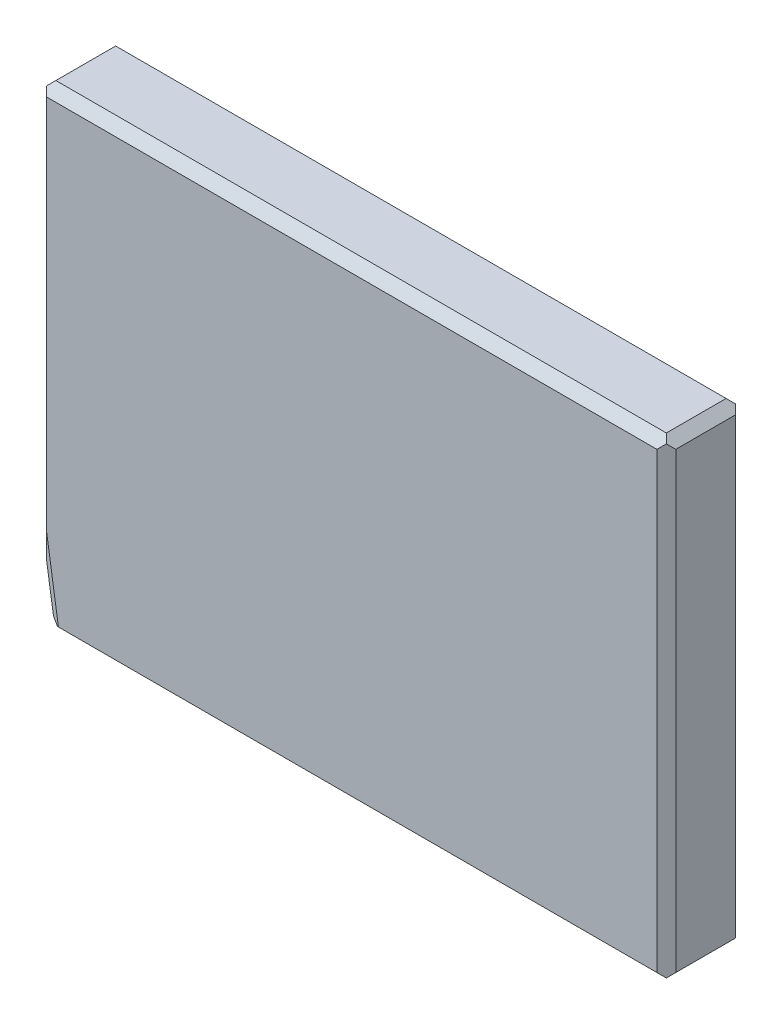
from build123d import *

# Parameters (mm, degrees)
SKETCH1_W        = 101.6
SKETCH1_H        = 76.2
PLATE_DEPTH      = 12.7
CHAMFER1_SIZE    = 1.524
CHAMFER3_SIZE    = 1.524
CHAMFER5_SIZE    = 1.524
CHAMFER7_SIZE    = 1.524
CHAMFER7_SIZE2   = 4.163645431
CHAMFER9_SIZE    = 1.524
CHAMFER9_SIZE2   = 4.163645431
CHAMFER10_SIZE   = 1.524
CHAMFER10_SIZE2  = 4.163645431
CHAMFER11_SIZE   = 1.524
CHAMFER11_SIZE2  = 1.98931977
CHAMFER12_SIZE   = 1.524
CHAMFER12_SIZE2  = 1.98931977
CHAMFER14_SIZE   = 1.524
CHAMFER14_SIZE2  = 2.500509831
CHAMFER18_SIZE   = 1.524
CHAMFER18_SIZE2  = 1.98931977
CHAMFER19_SIZE   = 4.927310365
CHAMFER19_SIZE_2 = 1.524
CHAMFER27_SIZE   = 4.163645431
CHAMFER27_SIZE_2 = 1.524
CHAMFER29_SIZE   = 1.524
CHAMFER33_SIZE   = 1.524
CHAMFER37_SIZE   = 1.524
CHAMFER41_SIZE   = 1.524
CHAMFER43_SIZE   = 1.524
CHAMFER47_SIZE   = 1.524
CHAMFER52_SIZE   = 1.524
CHAMFER57_SIZE   = 1.524
CHAMFER59_SIZE   = 1.524
CHAMFER63_SIZE   = 1.524
CHAMFER68_SIZE   = 1.524


with BuildPart() as part:
    # Sketch1 → plate (new body)
    with BuildSketch(Plane.XY):
        with Locations((50.8, 38.1)):
            Rectangle(SKETCH1_W, SKETCH1_H)
    extrude(amount=PLATE_DEPTH)

    # Chamfer1
    chamfer1_edges = [part.edges().sort_by_distance(p)[0] for p in [
        (0, 0, 6.35),
    ]]
    chamfer(chamfer1_edges, length=CHAMFER1_SIZE)

    # Chamfer3
    chamfer3_edges = [part.edges().sort_by_distance(p)[0] for p in [
        (0.762, 0.762, 0),
    ]]
    chamfer(chamfer3_edges, length=CHAMFER3_SIZE)

    # Chamfer5
    chamfer5_edges = [part.edges().sort_by_distance(p)[0] for p in [
        (0.762, 0.762, 12.7),
    ]]
    chamfer(chamfer5_edges, length=CHAMFER5_SIZE)

    # Chamfer7
    chamfer7_edges = [part.edges().sort_by_distance(p)[0] for p in [
        (0, 2.601630735, 0.762),
    ]]
    chamfer7_side = [part.faces().sort_by_distance(p)[0] for p in [
        (1.375210245, 1.375210245, 0.656789755),
    ]]
    chamfer(chamfer7_edges, length=CHAMFER7_SIZE, length2=CHAMFER7_SIZE2, reference=chamfer7_side[0])

    # Chamfer9
    chamfer9_edges = [part.edges().sort_by_distance(p)[0] for p in [
        (2.601630735, 0, 0.762),
    ]]
    chamfer9_side = [part.faces().sort_by_distance(p)[0] for p in [
        (2.111722816, 0.7919001, 0.548459281),
    ]]
    chamfer(chamfer9_edges, length=CHAMFER9_SIZE, length2=CHAMFER9_SIZE2, reference=chamfer9_side[0])

    # Chamfer10
    chamfer10_edges = [part.edges().sort_by_distance(p)[0] for p in [
        (0, 2.601630735, 11.938),
    ]]
    chamfer10_side = [part.faces().sort_by_distance(p)[0] for p in [
        (1.375210245, 1.375210245, 12.043210245),
    ]]
    chamfer(chamfer10_edges, length=CHAMFER10_SIZE, length2=CHAMFER10_SIZE2, reference=chamfer10_side[0])

    # Chamfer11
    chamfer11_edges = [part.edges().sort_by_distance(p)[0] for p in [
        (0.659911358, 6.625172827, 0),
    ]]
    chamfer11_side = [part.faces().sort_by_distance(p)[0] for p in [
        (0.497022665, 4.4128662, 2.308870295),
    ]]
    chamfer(chamfer11_edges, length=CHAMFER11_SIZE, length2=CHAMFER11_SIZE2, reference=chamfer11_side[0])

    # Chamfer12
    chamfer12_edges = [part.edges().sort_by_distance(p)[0] for p in [
        (7.206175842, 0.570029878, 0),
    ]]
    chamfer12_side = [part.faces().sort_by_distance(p)[0] for p in [
        (4.492487224, 0.46863969, 2.38230292),
    ]]
    chamfer(chamfer12_edges, length=CHAMFER12_SIZE, length2=CHAMFER12_SIZE2, reference=chamfer12_side[0])

    # Chamfer14
    chamfer14_edges = [part.edges().sort_by_distance(p)[0] for p in [
        (0.96943787, 0.96943787, 2.584421635),
    ]]
    chamfer14_side = [part.faces().sort_by_distance(p)[0] for p in [
        (3.644155143, 0.409792278, 3.25114463),
    ]]
    chamfer(chamfer14_edges, length=CHAMFER14_SIZE, length2=CHAMFER14_SIZE2, reference=chamfer14_side[0])

    # Chamfer18
    chamfer18_edges = [part.edges().sort_by_distance(p)[0] for p in [
        (0.659911358, 6.625172827, 12.7),
    ]]
    chamfer18_side = [part.faces().sort_by_distance(p)[0] for p in [
        (0.533202333, 4.341451886, 10.506002546),
    ]]
    chamfer(chamfer18_edges, length=CHAMFER18_SIZE, length2=CHAMFER18_SIZE2, reference=chamfer18_side[0])

    # Chamfer19
    # the kernel refuses this chamfer: 4.927310365, 1.524 mm, written as the material it takes off along each edge
    with BuildSketch(Plane(origin=(0, -3.953536059, 2.744587717), x_dir=(0, 0.09805092210800737, 0.9951813988785008), z_dir=(0, 0.9951813988785007, -0.09805092210800735))) as chamfer19_piece_1:
        Polygon((CHAMFER19_SIZE, 0), (-CHAMFER19_SIZE_2 * 0.53534007825, CHAMFER19_SIZE_2 * 0.844636608619), (0, 0), align=None)
    extrude(amount=91.989112447, mode=Mode.SUBTRACT)

    # Chamfer27
    # the kernel refuses this chamfer: 4.163645431, 1.524 mm, written as the material it takes off along each edge
    with BuildSketch(Plane(origin=(-7.303820514, 0, 4.933788251), x_dir=(0.5773502691896255, 0, -0.8164965809277261), z_dir=(0.8164965809277263, 0, 0.5773502691896256))) as chamfer27_piece_1:
        Polygon((CHAMFER27_SIZE, 0), (-CHAMFER27_SIZE_2 * 0.5, CHAMFER27_SIZE_2 * 0.866025403784), (0, 0), align=None)
    extrude(amount=24.057251609, mode=Mode.SUBTRACT)

    # Chamfer29
    chamfer29_edges = [part.edges().sort_by_distance(p)[0] for p in [
        (101.6, 0, 6.35),
    ]]
    chamfer(chamfer29_edges, length=CHAMFER29_SIZE)

    # Chamfer33
    chamfer33_edges = [part.edges().sort_by_distance(p)[0] for p in [
        (101.6, 76.2, 6.35),
    ]]
    chamfer(chamfer33_edges, length=CHAMFER33_SIZE)

    # Chamfer37
    chamfer37_edges = [part.edges().sort_by_distance(p)[0] for p in [
        (0, 76.2, 6.35),
    ]]
    chamfer(chamfer37_edges, length=CHAMFER37_SIZE)

    # Chamfer41
    chamfer41_edges = [part.edges().sort_by_distance(p)[0] for p in [
        (50.8, 76.2, 12.7),
    ]]
    chamfer(chamfer41_edges, length=CHAMFER41_SIZE)

    # Chamfer43
    chamfer43_edges = [part.edges().sort_by_distance(p)[0] for p in [
        (101.6, 38.1, 12.7),
    ]]
    chamfer(chamfer43_edges, length=CHAMFER43_SIZE)

    # Chamfer47
    chamfer47_edges = [part.edges().sort_by_distance(p)[0] for p in [
        (55.48345345, 0, 12.7),
    ]]
    chamfer(chamfer47_edges, length=CHAMFER47_SIZE)

    # Chamfer52
    chamfer52_edges = [part.edges().sort_by_distance(p)[0] for p in [
        (0, 49.289518337, 12.7),
    ]]
    chamfer(chamfer52_edges, length=CHAMFER52_SIZE)

    # Chamfer57
    chamfer57_edges = [part.edges().sort_by_distance(p)[0] for p in [
        (50.8, 76.2, 0),
    ]]
    chamfer(chamfer57_edges, length=CHAMFER57_SIZE)

    # Chamfer59
    chamfer59_edges = [part.edges().sort_by_distance(p)[0] for p in [
        (101.6, 38.1, 0),
    ]]
    chamfer(chamfer59_edges, length=CHAMFER59_SIZE)

    # Chamfer63
    chamfer63_edges = [part.edges().sort_by_distance(p)[0] for p in [
        (61.989518337, 0, 0),
    ]]
    chamfer(chamfer63_edges, length=CHAMFER63_SIZE)

    # Chamfer68
    chamfer68_edges = [part.edges().sort_by_distance(p)[0] for p in [
        (0, 74.415800982, 0),
    ]]
    chamfer(chamfer68_edges, length=CHAMFER68_SIZE)


solid = part.part
